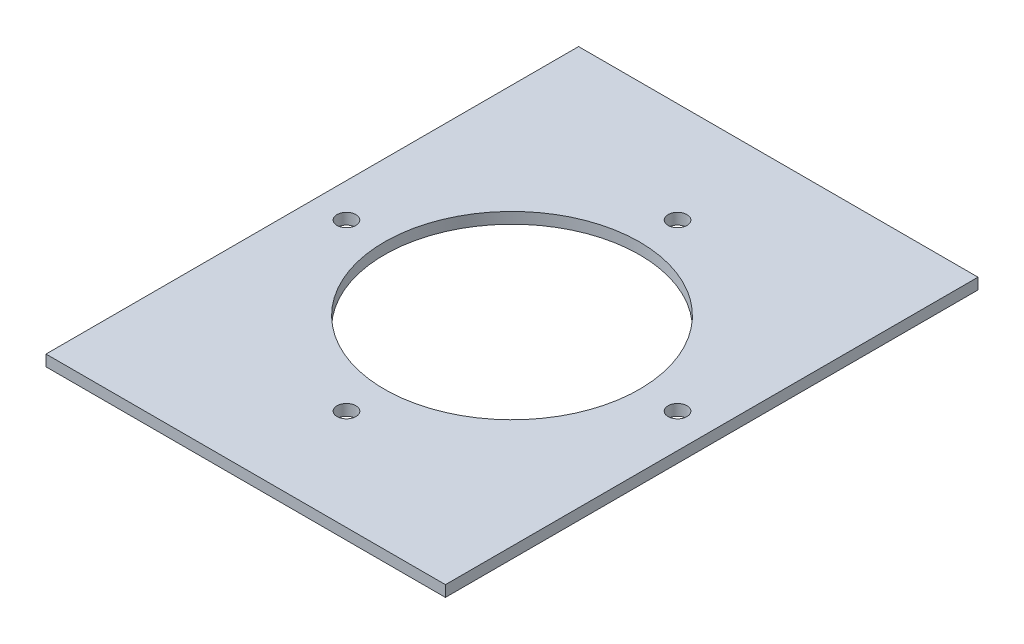
from build123d import *

# Parameters (mm, degrees)
SZKIC1_W                    = 180
SZKIC1_H                    = 240
DODANIE_WYCI_GNI_CIE1_DEPTH = 5
SZKIC2_R                    = 57.5
SZKIC2_R_2                  = 4.25
WYTNIJ_WYCI_GNI_CIE1_DEPTH  = 43
SZYK_KO_OWY1_COUNT          = 4


with BuildPart() as part:
    # Szkic1 → Dodanie-wyciągnięcie1 (new body)
    with BuildSketch(Plane(origin=(0, 0, 0), x_dir=(1, 0, 0), z_dir=(0, 1, 0))):
        Rectangle(SZKIC1_W, SZKIC1_H)
    extrude(amount=DODANIE_WYCI_GNI_CIE1_DEPTH)

    # Szkic2 → Wytnij-wyciągnięcie1 (cut)
    with BuildSketch(Plane(origin=(0, 0, 0), x_dir=(1, 0, 0), z_dir=(0, 1, 0))):
        Circle(SZKIC2_R)
        with Locations((0, 74.6)):
            Circle(SZKIC2_R_2)
    wytnij_wyci_gni_cie1 = extrude(amount=WYTNIJ_WYCI_GNI_CIE1_DEPTH, mode=Mode.SUBTRACT)

    # Szyk kołowy1: Wytnij-wyciągnięcie1 ×4 about axis
    szyk_ko_owy1_axis = Axis((0, 5, 0), (0, 1, 0))
    for i in range(1, SZYK_KO_OWY1_COUNT):
        add(wytnij_wyci_gni_cie1.rotate(szyk_ko_owy1_axis, i * 360 / SZYK_KO_OWY1_COUNT), mode=Mode.SUBTRACT)


solid = part.part
